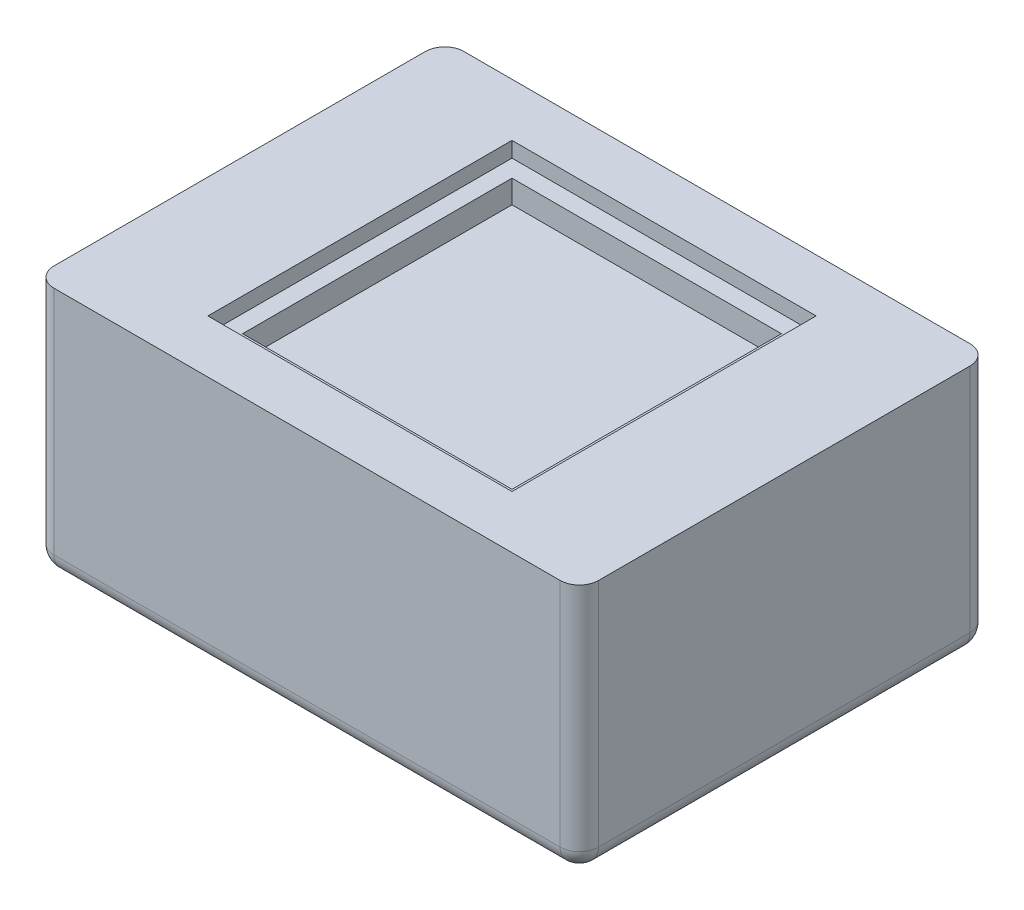
from build123d import *

# Parameters (mm, degrees)
SKETCH_1_W          = 28.3
SKETCH_1_H          = 21.3
EXTRUDE_1_DEPTH     = 13
FILLET_1_R          = 1
SKETCH_3_W          = 14
SKETCH_3_H          = 14
CUT_EXTRUDE_2_DEPTH = 2
SKETCH_4_W          = 15.8
SKETCH_4_H          = 15.8
CUT_EXTRUDE_3_DEPTH = 0.8
FILLET_2_R          = 1


with BuildPart() as part:
    # 草图1 → 凸台-拉伸1 (new body)
    with BuildSketch(Plane(origin=(0, 0, 0), x_dir=(1, 0, 0), z_dir=(0, 1, 0))):
        Rectangle(SKETCH_1_W, SKETCH_1_H)
    extrude(amount=EXTRUDE_1_DEPTH)

    # 圆角1
    fillet_1_edges = [part.edges().sort_by_distance(p)[0] for p in [
        (14.15, 6.5, 10.65),
        (-14.15, 6.5, 10.65),
        (-14.15, 6.5, -10.65),
        (14.15, 6.5, -10.65),
    ]]
    fillet(fillet_1_edges, radius=FILLET_1_R)

    # 草图3 → 切除-拉伸2 (cut)
    with BuildSketch(Plane(origin=(0, 13, 0), x_dir=(1, 0, 0), z_dir=(0, 1, 0))):
        Rectangle(SKETCH_3_W, SKETCH_3_H)
    extrude(amount=-CUT_EXTRUDE_2_DEPTH, mode=Mode.SUBTRACT)

    # 草图4 → 切除-拉伸3 (cut)
    with BuildSketch(Plane(origin=(0, 13, 0), x_dir=(1, 0, 0), z_dir=(0, 1, 0))):
        Rectangle(SKETCH_4_W, SKETCH_4_H)
    extrude(amount=-CUT_EXTRUDE_3_DEPTH, mode=Mode.SUBTRACT)

    # 圆角2
    fillet_2_edges = [part.edges().sort_by_distance(p)[0] for p in [
        (0, 0, -10.65),
        (14.15, 0, 0),
        (13.857106781, 0, 10.357106781),
        (13.857106781, 0, -10.357106781),
        (-13.857106781, 0, -10.357106781),
        (-13.857106781, 0, 10.357106781),
        (0, 0, 10.65),
        (-14.15, 0, 0),
    ]]
    fillet(fillet_2_edges, radius=FILLET_2_R)


solid = part.part
